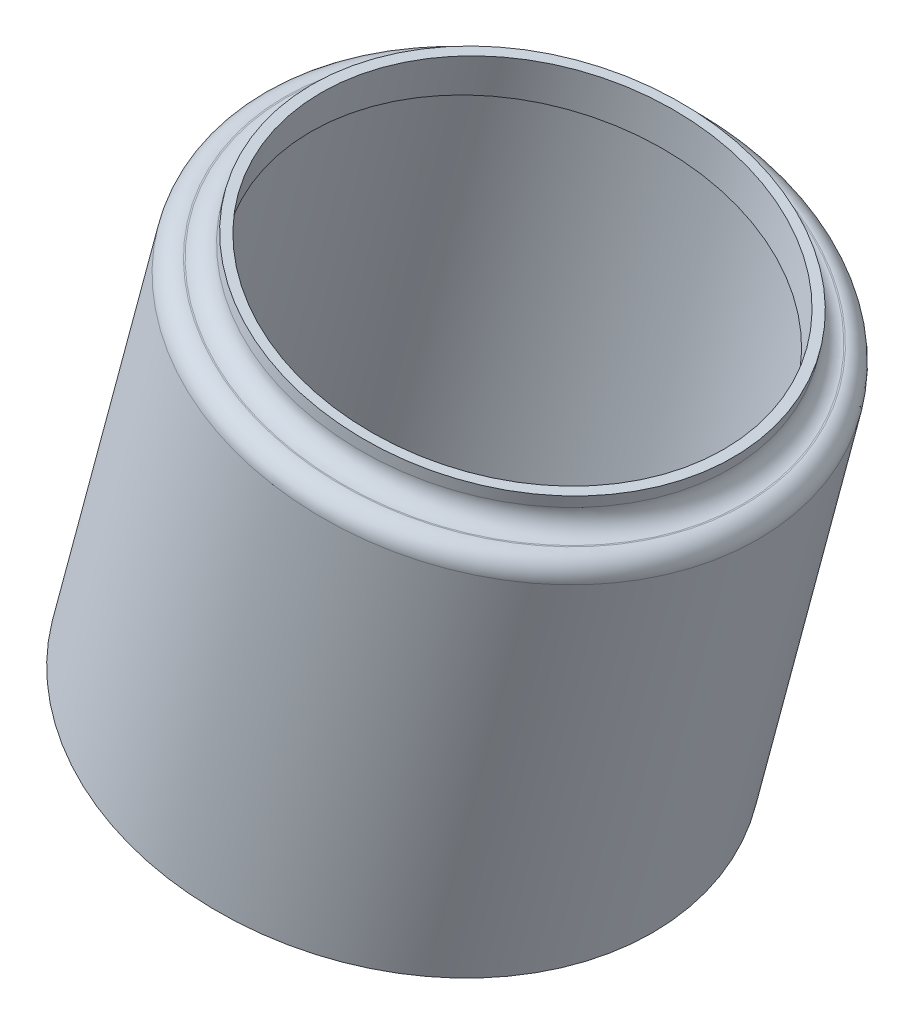
from build123d import *


with BuildPart() as part:
    # Sketch1 → Revolve1 (revolve)
    with BuildSketch(Plane.XY):
        with BuildLine():
            Line((114.170121614, -21.739380235), (117.046248252, -11.00552949))
            Line((117.046248252, -11.00552949), (116.034199468, -10.734351836))
            Line((116.034199468, -10.734351836), (116.313594627, -9.691634906))
            Line((116.313594627, -9.691634906), (116.558939787, -9.757374944))
            Line((116.558939787, -9.757374944), (116.47676474, -10.064056394))
            ThreePointArc((116.47676474, -10.064056394), (116.527514155, -10.449536469), (116.835974985, -10.686226788))
            Line((116.835974985, -10.686226788), (116.86664313, -10.694444293))
            ThreePointArc((116.86664313, -10.694444293), (117.17510396, -10.931134613), (117.225853375, -11.316614688))
            Line((117.225853375, -11.316614688), (114.415466774, -21.805120272))
            Line((114.415466774, -21.805120272), (114.170121614, -21.739380235))
        make_face()
    revolve(axis=Axis((111.07814933, -7.762881267, 0), (-0.25881904510251486, -0.9659258262890699, 0)))


solid = part.part
